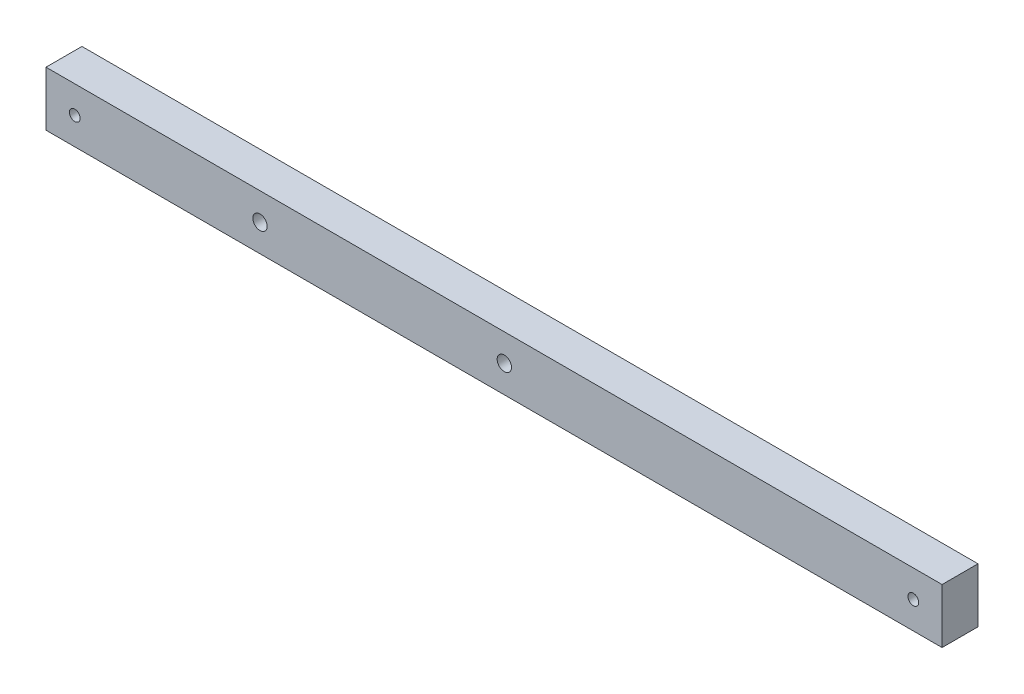
from build123d import *

# Parameters (mm, degrees)
SKETCH_2_W          = 62.35
SKETCH_2_H          = 3.8
SKETCH_2_R          = 0.5
EXTRUDE_1_DEPTH     = 2.5
CUT_EXTRUDE_1_REACH = 33.333
SKETCH_3_R          = 0.375


with BuildPart() as part:
    # 草图2 → 凸台-拉伸1 (new body)
    with BuildSketch(Plane.XY):
        Rectangle(SKETCH_2_W, SKETCH_2_H)
        with Locations((0.715777102, 0)):
            Circle(SKETCH_2_R, mode=Mode.SUBTRACT)
        with Locations((-16.284222898, 0)):
            Circle(SKETCH_2_R, mode=Mode.SUBTRACT)
    extrude(amount=EXTRUDE_1_DEPTH)

    # 草图3 → 切除-拉伸1 (cut, up to next)
    with BuildSketch(Plane(origin=(0, 0, 0), x_dir=(-1, 0, 0), z_dir=(0, 0, -1)), mode=Mode.PRIVATE) as cut_extrude_1_sk1:
        with Locations((29.175, 0)):
            Circle(SKETCH_3_R)
    cut_extrude_1_tool1 = extrude(cut_extrude_1_sk1.sketch, amount=-CUT_EXTRUDE_1_REACH, mode=Mode.PRIVATE) & part.part
    # 草图3 → 切除-拉伸1 (cut, up to next)
    with BuildSketch(Plane(origin=(0, 0, 0), x_dir=(-1, 0, 0), z_dir=(0, 0, -1)), mode=Mode.PRIVATE) as cut_extrude_1_sk2:
        with Locations((-29.175, 0)):
            Circle(SKETCH_3_R)
    cut_extrude_1_tool2 = extrude(cut_extrude_1_sk2.sketch, amount=-CUT_EXTRUDE_1_REACH, mode=Mode.PRIVATE) & part.part
    add(cut_extrude_1_tool1.solids().sort_by_distance((-29.175, 0, 0))[0], mode=Mode.SUBTRACT)
    add(cut_extrude_1_tool2.solids().sort_by_distance((29.175, 0, 0))[0], mode=Mode.SUBTRACT)


solid = part.part
